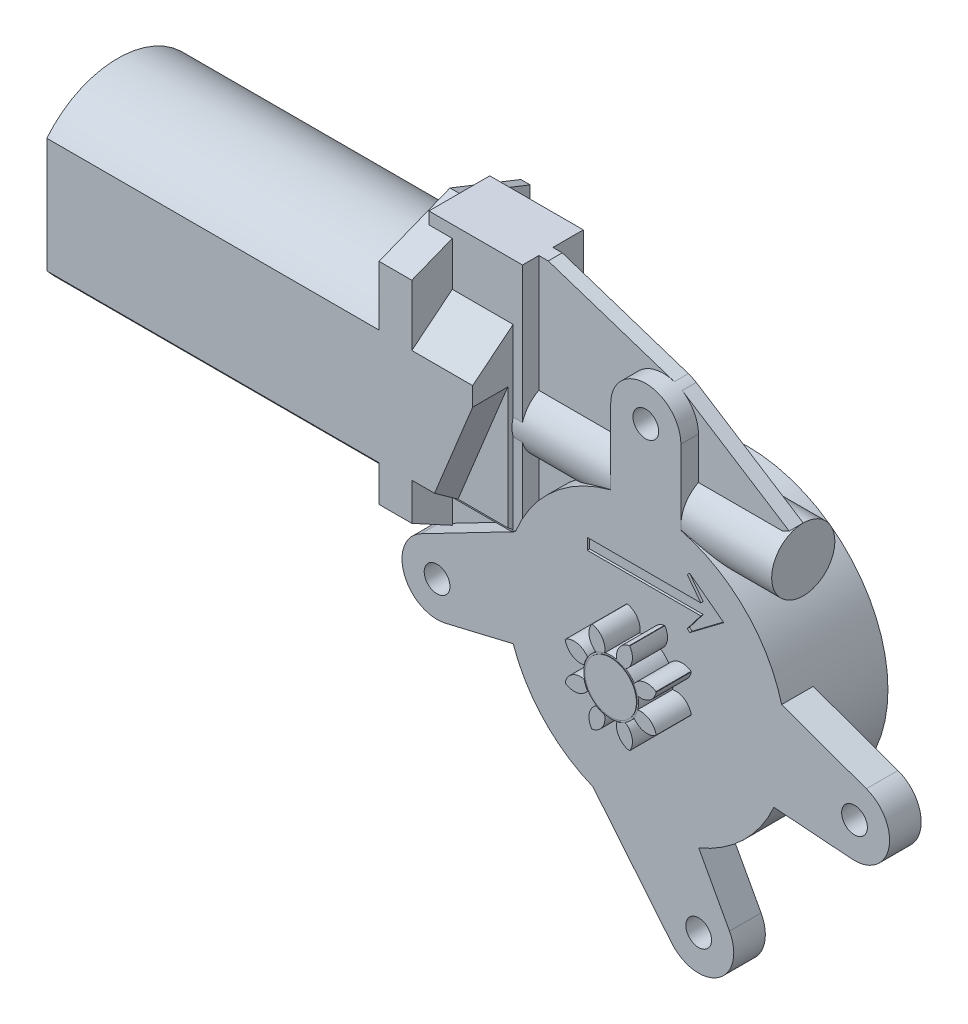
from build123d import *
from build123d.topology import SkipClean

# Parameters (mm, degrees)
EXTRUDE_1_DEPTH          = 71
SKETCH_3_R               = 7
EXTRUDE_2_DEPTH          = 0.8
SKETCH_4_R               = 2.25
EXTRUDE_3_DEPTH          = 0.2
SKETCH_5_R               = 2.5
SKETCH_5_R_2             = 2
EXTRUDE_4_DEPTH          = 2
SKETCH_7_R               = 6.75
EXTRUDE_7_DEPTH          = 73.5
SKETCH_6_R               = 30
EXTRUDE_8_DEPTH          = 15
EXTRUDE_START            = 6.75
SKETCH_8_R               = 2.75
EXTRUDE_9_DEPTH          = 6.75
EXTRUDE_START_2          = 3
SKETCH_9_R               = 2.75
EXTRUDE_10_DEPTH         = 3
EXTRUDE_11_DEPTH         = 6.5
EXTRUDE_11_DEPTH_BACK    = 6.5
SKETCH_10_W              = 20
SKETCH_10_H              = 50.5
EXTRUDE_19_DEPTH         = 18
SKETCH_13_R              = 10.5
EXTRUDE_20_DEPTH         = 7.5
SKETCH_14_R              = 5.85
SKETCH_14_R_2            = 5.5
CUT_EXTRUDE_1_DEPTH      = 0.1
CUT_EXTRUDE_2_DEPTH      = 7.5
EXTRUDE_23_DEPTH         = 5
CUT_EXTRUDE_3_DEPTH      = 0.5
CUT_EXTRUDE_4_DEPTH      = 7.5
PATTERN_CIRCULAR_1_COUNT = 8


with BuildPart() as part:
    # ｽｹｯﾁ2 → ﾎﾞｽ - 押し出し1 (new body)
    with BuildSketch(Plane(origin=(0, 0, 0), x_dir=(0, 0, -1), z_dir=(1, 0, 0))):
        with BuildLine():
            Line((15.15, 12.277112853), (15.15, -12.277112853))
            ThreePointArc((15.15, -12.277112853), (0, -19.5), (-15.15, -12.277112853))
            Line((-15.15, -12.277112853), (-15.15, 12.277112853))
            ThreePointArc((-15.15, 12.277112853), (0, 19.5), (15.15, 12.277112853))
        make_face()
    extrude(amount=-EXTRUDE_1_DEPTH)

    # ｽｹｯﾁ3 → ﾎﾞｽ - 押し出し2 (add)
    with BuildSketch(Plane.ZY.offset(71)):
        Circle(SKETCH_3_R)
    extrude(amount=EXTRUDE_2_DEPTH)

    # ｽｹｯﾁ4 → ﾎﾞｽ - 押し出し3 (add)
    with BuildSketch(Plane.ZY.offset(71.8)):
        Circle(SKETCH_4_R)
    extrude(amount=EXTRUDE_3_DEPTH)

    # ｽｹｯﾁ5 → ﾎﾞｽ - 押し出し4 (add)
    with BuildSketch(Plane(origin=(0, 0, 0), x_dir=(0, 0, -1), z_dir=(1, 0, 0))):
        Polygon((-15.15, 25), (-15.15, -20), (5.15, -31), (15.15, -31), (15.15, 25), (0, 31), align=None)
        with Locations((0, 26)):
            Circle(SKETCH_5_R, mode=Mode.SUBTRACT)
        with Locations((-10, 24)):
            Circle(SKETCH_5_R_2, mode=Mode.SUBTRACT)
        with Locations((10, 24)):
            Circle(SKETCH_5_R_2, mode=Mode.SUBTRACT)
        with Locations((7, -25.039968051)):
            Circle(SKETCH_5_R_2, mode=Mode.SUBTRACT)
    extrude(amount=EXTRUDE_4_DEPTH)

    # ｽｹｯﾁ7 → ﾎﾞｽ - 押し出し7 (add)
    with BuildSketch(Plane(origin=(2, 0, 0), x_dir=(0, 0, -1), z_dir=(1, 0, 0))):
        Circle(SKETCH_7_R)
    extrude(amount=EXTRUDE_7_DEPTH)

    # ｽｹｯﾁ6 → ﾎﾞｽ - 押し出し8 (add)
    with BuildSketch(Plane.XY):
        with Locations((48.6, -30)):
            Circle(SKETCH_6_R)
    extrude(amount=-EXTRUDE_8_DEPTH)

    # ｽｹｯﾁ8 → ﾎﾞｽ - 押し出し9 (add)
    with SkipClean():  # the faces are left unmerged after this step: merging them gives an invalid solid
        with BuildSketch(Plane.XY.offset(EXTRUDE_START)):
            with BuildLine():
                Line((54.103142752, -78.258828222), (37.3, -57.790465991))
                ThreePointArc((37.3, -57.790465991), (26.845559307, -50.657790543), (20.262693318, -39.848708037))
                Line((20.262693318, -39.848708037), (5.731866213, -43.297303572))
                ThreePointArc((5.731866213, -43.297303572), (-3.030535218, -38.611814416), (0.547494655, -29.341906666))
                Line((0.547494655, -29.341906666), (20.740658448, -18.87089005))
                ThreePointArc((20.740658448, -18.87089005), (28.779888618, -7.479716148), (41.1, -0.952624903))
                Line((41.1, -0.952624903), (41.1, 15))
                ThreePointArc((41.1, 15), (48.6, 22.5), (56.1, 15))
                Line((56.1, 15), (56.1, -0.952624903))
                ThreePointArc((56.1, -0.952624903), (69.784200745, -8.757833472), (77.626772672, -22.420655158))
                Line((77.626772672, -22.420655158), (95.741011533, -28.943566029))
                ThreePointArc((95.741011533, -28.943566029), (100.535659604, -37.561441057), (92.646930033, -43.479579775))
                Line((92.646930033, -43.479579775), (75.986056496, -42.247608321))
                ThreePointArc((75.986056496, -42.247608321), (69.445811281, -51.57434013), (59.9, -57.790465991))
                Line((59.9, -57.790465991), (66.490076017, -69.919371831))
                ThreePointArc((66.490076017, -69.919371831), (64.088547747, -79.721420077), (54.103142752, -78.258828222))
            make_face()
            with Locations((48.6, 15)):
                Circle(SKETCH_8_R, mode=Mode.SUBTRACT)
            with Locations((4, -36)):
                Circle(SKETCH_8_R, mode=Mode.SUBTRACT)
            with Locations((93.2, -36)):
                Circle(SKETCH_8_R, mode=Mode.SUBTRACT)
            with Locations((59.9, -73.5)):
                Circle(SKETCH_8_R, mode=Mode.SUBTRACT)
        extrude(amount=-EXTRUDE_9_DEPTH)

    # ｽｹｯﾁ9 → ﾎﾞｽ - 押し出し10 (add)
    with SkipClean():  # the faces are left unmerged after this step: merging them gives an invalid solid
        with BuildSketch(Plane.XY.offset(EXTRUDE_START_2)):
            with BuildLine():
                Line((2, -28.588720699), (75.5, 6.75))
                Line((75.5, 6.75), (52.630824586, 21.324749256))
                ThreePointArc((52.630824586, 21.324749256), (51.813602008, 21.77663354), (50.946558479, 22.123458662))
                Line((50.946558479, 22.123458662), (24, 31))
                Line((24, 31), (2, 31))
                Line((2, 31), (2, -28.588720699))
            make_face()
            with Locations((48.6, 15)):
                Circle(SKETCH_9_R, mode=Mode.SUBTRACT)
        extrude(amount=-EXTRUDE_10_DEPTH)

    # ｽｹｯﾁ10 → ﾎﾞｽ - 押し出し11 (add, two sides: drawn at the far end of the back side and taken through both)
    with SkipClean():  # the faces are left unmerged after this step: merging them gives an invalid solid
        with BuildSketch(Plane.XY.offset(-EXTRUDE_11_DEPTH_BACK)):
            with Locations((12, 5.75)):
                Rectangle(SKETCH_10_W, SKETCH_10_H)
        extrude(amount=EXTRUDE_11_DEPTH + EXTRUDE_11_DEPTH_BACK)

    # ｽｹｯﾁ12 → ﾎﾞｽ - 押し出し19 (add)
    with SkipClean():  # the faces are left unmerged after this step: merging them gives an invalid solid
        with BuildSketch(Plane(origin=(2, 0, 0), x_dir=(0, 0, -1), z_dir=(1, 0, 0))):
            Polygon((-15.15, 12), (-6.5, 19), (-6.5, -19), (-15.15, -12), align=None)
        extrude(amount=EXTRUDE_19_DEPTH)

    # ｽｹｯﾁ13 → ﾎﾞｽ - 押し出し20 (add)
    with SkipClean():  # the faces are left unmerged after this step: merging them gives an invalid solid
        with BuildSketch(Plane.XY.offset(6.75)):
            with Locations((48.6, -30)):
                Circle(SKETCH_13_R)
        extrude(amount=EXTRUDE_20_DEPTH)

    # ｽｹｯﾁ14 → ｶｯﾄ - 押し出し1 (cut)
    with SkipClean():  # the faces are left unmerged after this step: merging them gives an invalid solid
        with BuildSketch(Plane.XY.offset(14.25)):
            with Locations((48.6, -30)):
                Circle(SKETCH_14_R)
            with Locations((48.6, -30)):
                Circle(SKETCH_14_R_2, mode=Mode.SUBTRACT)
        extrude(amount=-CUT_EXTRUDE_1_DEPTH, mode=Mode.SUBTRACT)

    # ｽｹｯﾁ15 → ｶｯﾄ - 押し出し2 (cut)
    with SkipClean():  # the faces are left unmerged after this step: merging them gives an invalid solid
        with BuildSketch(Plane.XY.offset(15.15)):
            Polygon((20, 8), (9, -19), (20, -19), align=None)
        extrude(amount=-CUT_EXTRUDE_2_DEPTH, mode=Mode.SUBTRACT)

    # ｽｹｯﾁ16 → ﾎﾞｽ - 押し出し23 (add)
    with SkipClean():  # the faces are left unmerged after this step: merging them gives an invalid solid
        with BuildSketch(Plane(origin=(2, 0, 0), x_dir=(0, 0, -1), z_dir=(1, 0, 0))):
            Polygon((-6.5, 28.425742574), (-15.15, 25), (-15.15, -20), (-6.5, -24.687192118), align=None)
        extrude(amount=EXTRUDE_23_DEPTH)

    # ｽｹｯﾁ17 → ｶｯﾄ - 押し出し3 (cut)
    with SkipClean():  # the faces are left unmerged after this step: merging them gives an invalid solid
        with BuildSketch(Plane.XY.offset(6.75)):
            Polygon((57.97110506, -18.933265077), (57.465434211, -18.427594227), (60.373041595, -14.625698581), (36.100840823, -14.625698581), (36.100840823, -12.233126322), (60.373041595, -12.233126322), (57.465434211, -8.440594951), (57.97110506, -7.934924102), (65.176914664, -13.370885733), (65.176914664, -13.497303445), align=None)
        extrude(amount=-CUT_EXTRUDE_3_DEPTH, mode=Mode.SUBTRACT)

    # ｽｹｯﾁ18 → ｶｯﾄ - 押し出し4 (cut)
    with SkipClean():  # the faces are left unmerged after this step: merging them gives an invalid solid
        with BuildSketch(Plane.XY.offset(14.25)):
            with BuildLine():
                ThreePointArc((52.571987006, -20.28026136), (48.6, -19.5), (44.628012994, -20.28026136))
                ThreePointArc((44.628012994, -20.28026136), (46.806938273, -21.727754746), (47.287462433, -24.299145228))
                ThreePointArc((47.287462433, -24.299145228), (48.6, -24.15), (49.912537567, -24.299145228))
                ThreePointArc((49.912537567, -24.299145228), (50.393061727, -21.727754746), (52.571987006, -20.28026136))
            make_face()
        cut_extrude_4 = extrude(amount=-CUT_EXTRUDE_4_DEPTH, mode=Mode.SUBTRACT)

    # 円形ﾊﾟﾀｰﾝ1: ｶｯﾄ - 押し出し4 ×8 about axis
    with SkipClean():  # the faces are left unmerged after this step: merging them gives an invalid solid
        pattern_circular_1_axis = Axis((48.6, -30, -7.5), (0, 0, 1))
        for i in range(1, PATTERN_CIRCULAR_1_COUNT):
            add(cut_extrude_4.rotate(pattern_circular_1_axis, i * 360 / PATTERN_CIRCULAR_1_COUNT), mode=Mode.SUBTRACT)


solid = part.part
